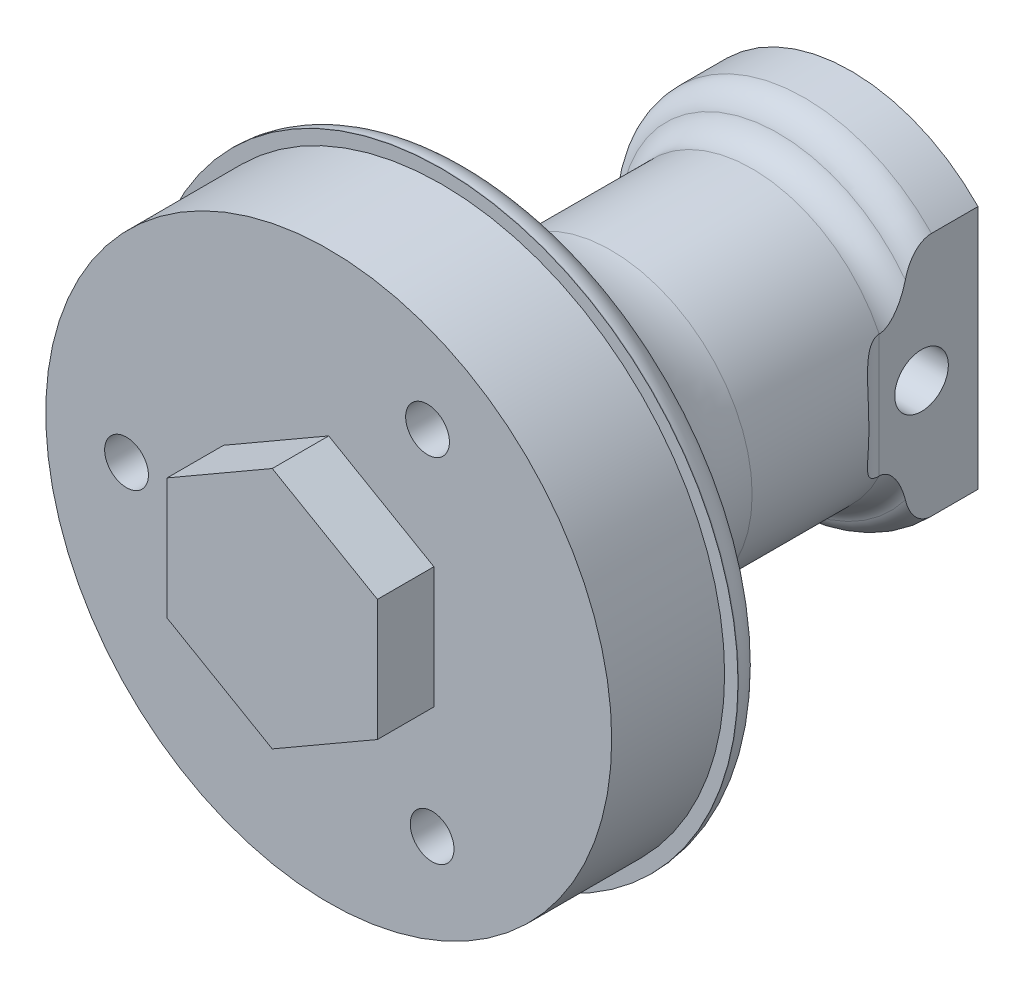
from build123d import *

# Parameters (mm, degrees)
BOSS_EXTRUDE1_DEPTH = 4
SKETCH2_R           = 10
BOSS_EXTRUDE2_DEPTH = 37
SKETCH3_R           = 1.2
CUT_EXTRUDE2_DEPTH  = 11
SKETCH6_R           = 20.05
BOSS_EXTRUDE4_DEPTH = 10
SKETCH15_R          = 21
BOSS_EXTRUDE7_DEPTH = 2
CUT_EXTRUDE4_REACH  = 49.445
SKETCH7_R           = 1.55
BOSS_EXTRUDE6_START = -5
SKETCH14_R          = 12.5
SKETCH14_R_2        = 10
BOSS_EXTRUDE6_DEPTH = 5
CUT_EXTRUDE5_REACH  = 54.058
SKETCH12_W          = 9
SKETCH12_H          = 20
SKETCH13_R          = 1.9
CUT_EXTRUDE6_DEPTH  = 9
FILLET1_R           = 10
FILLET2_R           = 2
FILLET3_R           = 2
FILLET4_R           = 2
FILLET5_R           = 2
SKETCH17_R          = 3
CUT_EXTRUDE8_DEPTH  = 10


# Some blends are built 0.0001 mm under size
with BuildPart() as part:
    # Sketch1 → Boss-Extrude1 (new body)
    with BuildSketch(Plane.XY):
        Polygon((0, 8.602519011), (-7.45, 4.301259505), (-7.45, -4.301259505), (0, -8.602519011), (7.45, -4.301259505), (7.45, 4.301259505), align=None)
    extrude(amount=BOSS_EXTRUDE1_DEPTH)

    # Sketch2 → Boss-Extrude2 (add)
    with BuildSketch(Plane(origin=(0, 0, 0), x_dir=(-1, 0, 0), z_dir=(0, 0, -1))):
        Circle(SKETCH2_R)
    extrude(amount=BOSS_EXTRUDE2_DEPTH)

    # Sketch3 → Cut-Extrude2 (cut)
    with BuildSketch(Plane(origin=(0, 0, -37), x_dir=(-1, 0, 0), z_dir=(0, 0, -1))):
        Circle(SKETCH3_R)
    extrude(amount=-CUT_EXTRUDE2_DEPTH, mode=Mode.SUBTRACT)

    # Sketch6 → Boss-Extrude4 (add)
    with BuildSketch(Plane.XY):
        Circle(SKETCH6_R)
    extrude(amount=-BOSS_EXTRUDE4_DEPTH)

    # Sketch15 → Boss-Extrude7 (add)
    with BuildSketch(Plane(origin=(0, 0, -10), x_dir=(-1, 0, 0), z_dir=(0, 0, -1))):
        Circle(SKETCH15_R)
    extrude(amount=-BOSS_EXTRUDE7_DEPTH)

    # Sketch7 → Cut-Extrude4 (cut, up to next)
    with BuildSketch(Plane.XY, mode=Mode.PRIVATE) as cut_extrude4_sk1:
        with Locations((7, 12.5)):
            Circle(SKETCH7_R)
    cut_extrude4_tool1 = extrude(cut_extrude4_sk1.sketch, amount=-CUT_EXTRUDE4_REACH, mode=Mode.PRIVATE) & part.part
    # Sketch7 → Cut-Extrude4 (cut, up to next)
    with BuildSketch(Plane.XY, mode=Mode.PRIVATE) as cut_extrude4_sk2:
        with Locations((7.325317547, -12.312177826)):
            Circle(SKETCH7_R)
    cut_extrude4_tool2 = extrude(cut_extrude4_sk2.sketch, amount=-CUT_EXTRUDE4_REACH, mode=Mode.PRIVATE) & part.part
    # Sketch7 → Cut-Extrude4 (cut, up to next)
    with BuildSketch(Plane.XY, mode=Mode.PRIVATE) as cut_extrude4_sk3:
        with Locations((-14.325317547, -0.187822174)):
            Circle(SKETCH7_R)
    cut_extrude4_tool3 = extrude(cut_extrude4_sk3.sketch, amount=-CUT_EXTRUDE4_REACH, mode=Mode.PRIVATE) & part.part
    add(cut_extrude4_tool1.solids().sort_by_distance((7, 12.5, 0))[0], mode=Mode.SUBTRACT)
    add(cut_extrude4_tool2.solids().sort_by_distance((7.325318, -12.312178, 0))[0], mode=Mode.SUBTRACT)
    add(cut_extrude4_tool3.solids().sort_by_distance((-14.325318, -0.187822, 0))[0], mode=Mode.SUBTRACT)

    # Sketch14 → Boss-Extrude6 (add)
    with BuildSketch(Plane(origin=(0, 0, -37), x_dir=(-1, 0, 0), z_dir=(0, 0, -1)).offset(BOSS_EXTRUDE6_START)):
        Circle(SKETCH14_R)
        with Locations(Location((0, 0, 0), (0, 0, 180))):
            Circle(SKETCH14_R_2, mode=Mode.SUBTRACT)
    extrude(amount=BOSS_EXTRUDE6_DEPTH)

    # Sketch12 → Cut-Extrude5 (cut, up to next)
    with BuildSketch(Plane(origin=(9, 0, 0), x_dir=(0, 0, -1), z_dir=(1, 0, 0)), mode=Mode.PRIVATE) as cut_extrude5_sk1:
        with Locations((32.5, 0)):
            Rectangle(SKETCH12_W, SKETCH12_H)
    cut_extrude5_tool1 = extrude(cut_extrude5_sk1.sketch, amount=CUT_EXTRUDE5_REACH, mode=Mode.PRIVATE) & part.part
    add(cut_extrude5_tool1.solids().sort_by_distance((9, 0, -32.5))[0], mode=Mode.SUBTRACT)

    # Sketch13 → Cut-Extrude6 (cut, symmetric)
    with BuildSketch(Plane(origin=(9, 0, 0), x_dir=(0, 0, -1), z_dir=(1, 0, 0))):
        with Locations((33, 0)):
            Circle(SKETCH13_R)
    extrude(amount=CUT_EXTRUDE6_DEPTH, both=True, mode=Mode.SUBTRACT)

    # Fillet1
    # the kernel refuses this fillet: 10 mm, written as the material it adds along each edge
    with BuildSketch(Plane(origin=(0, 0, -10), x_dir=(-1, 0, 0), z_dir=(0, 1, 0))) as fillet1_piece_1_section:
        with BuildLine():
            CenterArc((10 + FILLET1_R, -FILLET1_R), FILLET1_R, 90, 90)
            Line((10, -FILLET1_R), (10, 0))
            Line((10, 0), (10 + FILLET1_R, 0))
        make_face()
    fillet1_piece_1 = revolve(axis=Axis((0, 0, -10), (0, 0, 1)), mode=Mode.PRIVATE)
    fillet1_piece_1 = fillet1_piece_1 - Plane(origin=(7.325317547, -12.312177826, -12.841052518), x_dir=(1, 0, 0), z_dir=(0, 0, 1)) * Cylinder(1.55, 80, mode=Mode.PRIVATE)
    fillet1_piece_1 = fillet1_piece_1 - Plane(origin=(-14.325317547, -0.187822174, -12.841052518), x_dir=(1, 0, 0), z_dir=(0, 0, 1)) * Cylinder(1.55, 80, mode=Mode.PRIVATE)
    fillet1_piece_1 = fillet1_piece_1 - Plane(origin=(7, 12.5, -12.841052518), x_dir=(1, 0, 0), z_dir=(0, 0, 1)) * Cylinder(1.55, 80, mode=Mode.PRIVATE)
    add(fillet1_piece_1)

    # Fillet2
    fillet2_edges = [part.edges().sort_by_distance(p)[0] for p in [
        (21, 0, -10),
    ]]
    fillet(fillet2_edges, radius=FILLET2_R - 0.0001)  # a hair under: the kernel refuses the full size

    # Fillet3
    fillet3_edges = [part.edges().sort_by_distance(p)[0] for p in [
        (-2.236067977, 9.746794345, -32),
    ]]
    fillet(fillet3_edges, radius=FILLET3_R)

    # Fillet4
    # the kernel refuses this fillet: 2 mm, written as the material it adds along each edge
    with BuildSketch(Plane(origin=(9, 9.358898944, -28), x_dir=(1, 0, 0), z_dir=(0, -1, 0))) as fillet4_piece_1_section:
        with BuildLine():
            CenterArc((FILLET4_R, -FILLET4_R), FILLET4_R, 90, 90)
            Line((0, -FILLET4_R), (0, 0))
            Line((0, 0), (FILLET4_R, 0))
        make_face()
    fillet4_piece_1 = extrude(amount=18.717797887, mode=Mode.PRIVATE)
    fillet4_piece_1 = fillet4_piece_1 & Plane(origin=(0, 0, -28.566638375), x_dir=(-1, 0, 0), z_dir=(0, 0, 1)) * Cylinder(10, 46, mode=Mode.PRIVATE)
    add(fillet4_piece_1)

    # Fillet5
    fillet5_edges = [part.edges().sort_by_distance(p)[0] for p in [
        (-12.5, 0, -32),
    ]]
    fillet(fillet5_edges, radius=FILLET5_R)

    # Sketch17 → Cut-Extrude8 (cut)
    with BuildSketch(Plane.XY.offset(-10.5)):
        with Locations((7, 12.5)):
            Circle(SKETCH17_R)
        with Locations((7.325317547, -12.312177826)):
            Circle(SKETCH17_R)
        with Locations((-14.325317547, -0.187822174)):
            Circle(SKETCH17_R)
    extrude(amount=-CUT_EXTRUDE8_DEPTH, mode=Mode.SUBTRACT)


solid = part.part
